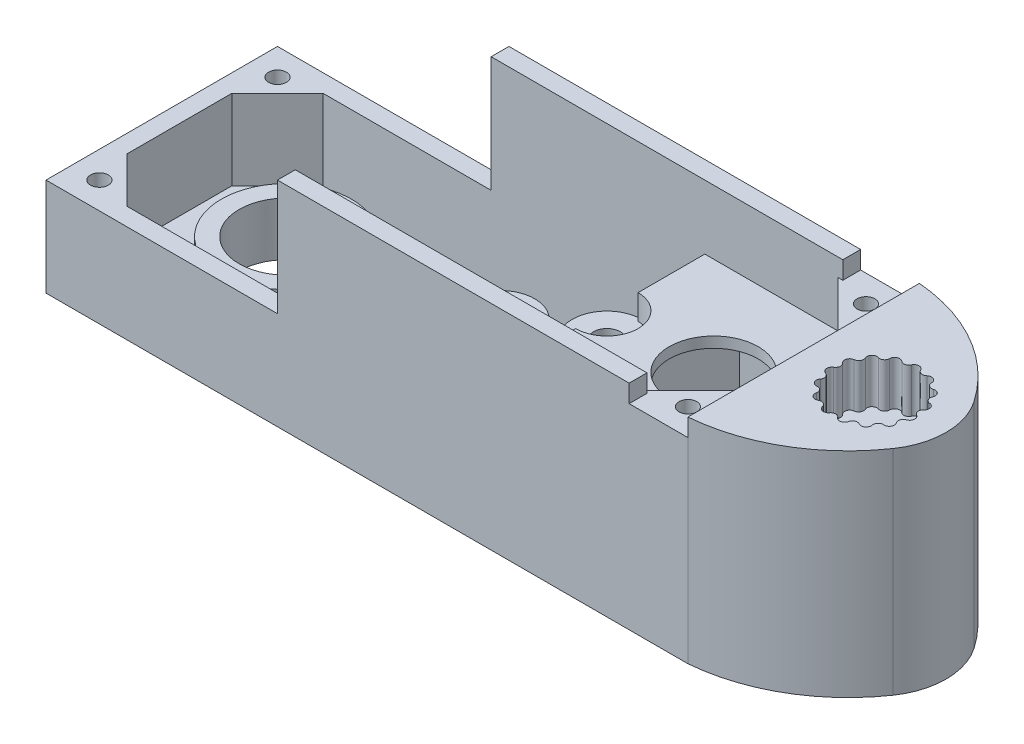
from build123d import *
from build123d.topology import SkipClean

# Parameters (mm, degrees)
ESQUISSE2_W                 = 36.05
ESQUISSE2_H                 = 13
ESQUISSE2_W_2               = 34.05
ESQUISSE2_H_2               = 11
BOSS_EXTRU_1_DEPTH          = 12
ESQUISSE3_W                 = 13
ESQUISSE3_H                 = 1
BOSS_EXTRU_2_DEPTH          = 36.05
ESQUISSE4_R                 = 2.65
ENL_V_MAT_EXTRU_1_DEPTH     = 12
ESQUISSE6_W                 = 3.9
ESQUISSE6_H                 = 1.5
ESQUISSE6_H_2               = 5
ESQUISSE6_H_3               = 7
BOSS_EXTRU_3_DEPTH          = 13
ENL_V_START                 = -6
ENL_V_MAT_EXTRU_2_OUTLINE_R = 0.75
ENL_V_MAT_EXTRU_2_DEPTH     = 6
ESQUISSE8_W                 = 13
ESQUISSE8_H                 = 6.5
ENL_V_MAT_EXTRU_3_DEPTH     = 40.261972696
ESQUISSE9_W                 = 8.1
ESQUISSE9_H                 = 11
BOSS_EXTRU_5_DEPTH          = 1.4
ESQUISSE11_R                = 2.5
ENL_V_MAT_EXTRU_4_DEPTH     = 38.987662471
CONG_2_R                    = 2
ESQUISSE10_W                = 8.1
ESQUISSE10_H                = 11
ENL_V_MAT_EXTRU_5_DEPTH     = 0.8
BOSS_EXTRU_6_DEPTH          = 2.6
ESQUISSE14_R                = 0.5
ENL_V_MAT_EXTRU_7_DEPTH     = 39.645860063
ESQUISSE15_R                = 0.75
ENL_V_MAT_EXTRU_8_DEPTH     = 38.702818197
ESQUISSE16_W                = 3.3
ESQUISSE16_H                = 13
ENL_V_MAT_EXTRU_9_DEPTH     = 1
ESQUISSE18_R                = 3.65
ESQUISSE18_R_2              = 2.65
BOSS_EXTRU_7_DEPTH          = 2
BOSS_EXTRU_8_REACH          = 40.942
ESQUISSE21_R                = 2.7
ENL_V_MAT_EXTRU_10_DEPTH    = 9.5
BOSS_EXTRU_9_START          = 3.5
ESQUISSE22_R                = 2.7
ESQUISSE22_R_2              = 1
BOSS_EXTRU_9_DEPTH          = 3.5


# Read off the part's stored shape, not the designer's step: Enlèv. mat.-Extru.2
with BuildPart() as part:
    # Esquisse2 → Boss.-Extru.1 (new body)
    # profile 1 of 3: a face of its own
    with BuildSketch(Plane(origin=(0, 0, 0), x_dir=(1, 0, 0), z_dir=(0, 1, 0))):
        with Locations((17.025, 5.5)):
            Rectangle(ESQUISSE2_W, ESQUISSE2_H)
        with Locations((17.025, 5.5)):
            Rectangle(ESQUISSE2_W_2, ESQUISSE2_H_2, mode=Mode.SUBTRACT)
    # profile 2 of 3: a face of its own
    with BuildSketch(Plane(origin=(0, 0, 0), x_dir=(1, 0, 0), z_dir=(0, 1, 0))):
        Polygon((0, 0), (2.560660172, 0), (0, 2.560660172), align=None)
    # profile 3 of 3: a face of its own
    with BuildSketch(Plane(origin=(0, 0, 0), x_dir=(1, 0, 0), z_dir=(0, 1, 0))):
        Polygon((0, 11), (0, 8.439339828), (2.560660172, 11), align=None)
    extrude(amount=BOSS_EXTRU_1_DEPTH)

    # Esquisse3 → Boss.-Extru.2 (add)
    with BuildSketch(Plane.ZY.offset(1)):
        with Locations((-5.5, 0.5)):
            Rectangle(ESQUISSE3_W, ESQUISSE3_H)
    extrude(amount=-BOSS_EXTRU_2_DEPTH)

    # Esquisse4 → Enlèv. mat.-Extru.1 (cut)
    with BuildSketch(Plane.XZ):
        with Locations(Location((6, -5.5, 0), (0, 0, 270))):
            Circle(ESQUISSE4_R)
        Polygon((34.05, 0), (28.45, 0), (25.95, -2.5), (25.95, -8.5), (28.45, -11), (34.05, -11), align=None)
    extrude(amount=-ENL_V_MAT_EXTRU_1_DEPTH, mode=Mode.SUBTRACT)

    # Esquisse6 → Boss.-Extru.3 (add)
    with BuildSketch(Plane.XY.offset(1)):
        with Locations((12, 0.75)):
            Rectangle(ESQUISSE6_W, ESQUISSE6_H)
        with Locations((18, 2.5)):
            Rectangle(ESQUISSE6_W, ESQUISSE6_H_2)
        with Locations((24, 3.5)):
            Rectangle(ESQUISSE6_W, ESQUISSE6_H_3)
    extrude(amount=-BOSS_EXTRU_3_DEPTH)

    # Enlèv. mat.-Extru.2 outline → Enlèv. mat.-Extru.2 (cut)
    with BuildSketch(Plane(origin=(0, 7, 0), x_dir=(1, 0, 0), z_dir=(0, 1, 0)).offset(ENL_V_START)):
        with BuildLine():
            Line((24, 7.45), (24, 11))
            Line((24, 11), (22.05, 11))
            Line((22.05, 11), (22.05, 5.5))
            ThreePointArc((22.05, 5.5), (22.621141777, 6.878858223), (24, 7.45))
        make_face()
        with BuildLine():
            Line((19.95, 5.5), (19.95, 11))
            Line((19.95, 11), (16.05, 11))
            Line((16.05, 11), (16.05, 5.5))
            ThreePointArc((16.05, 5.5), (18, 7.45), (19.95, 5.5))
        make_face()
        with BuildLine():
            ThreePointArc((24, 3.55), (22.621141777, 4.121141777), (22.05, 5.5))
            Line((22.05, 5.5), (22.05, 0))
            Line((22.05, 0), (24, 0))
            Line((24, 0), (24, 3.55))
        make_face()
        with BuildLine():
            Line((19.95, 0), (19.95, 5.5))
            ThreePointArc((19.95, 5.5), (18, 3.55), (16.05, 5.5))
            Line((16.05, 5.5), (16.05, 0))
            Line((16.05, 0), (19.95, 0))
        make_face()
        with BuildLine():
            Line((13.95, 5.5), (13.95, 11))
            Line((13.95, 11), (10.05, 11))
            Line((10.05, 11), (10.05, 5.5))
            ThreePointArc((10.05, 5.5), (12, 7.45), (13.95, 5.5))
        make_face()
        with BuildLine():
            Line((13.95, 0), (13.95, 5.5))
            ThreePointArc((13.95, 5.5), (12, 3.55), (10.05, 5.5))
            Line((10.05, 5.5), (10.05, 0))
            Line((10.05, 0), (13.95, 0))
        make_face()
        with Locations((24, 5.5)):
            Circle(ENL_V_MAT_EXTRU_2_OUTLINE_R)
        with Locations((18, 5.5)):
            Circle(ENL_V_MAT_EXTRU_2_OUTLINE_R)
        with Locations((12, 5.5)):
            Circle(ENL_V_MAT_EXTRU_2_OUTLINE_R)
    extrude(amount=ENL_V_MAT_EXTRU_2_DEPTH, mode=Mode.SUBTRACT)

    # Esquisse8 → Enlèv. mat.-Extru.3 (cut, through all)
    with BuildSketch(Plane(origin=(0, 0, -12), x_dir=(-1, 0, 0), z_dir=(0, 0, -1))):
        with Locations((-5.5, 8.75)):
            Rectangle(ESQUISSE8_W, ESQUISSE8_H)
    extrude(amount=-ENL_V_MAT_EXTRU_3_DEPTH, mode=Mode.SUBTRACT)

    # Esquisse9 → Boss.-Extru.5 (add)
    with BuildSketch(Plane(origin=(0, 7, 0), x_dir=(1, 0, 0), z_dir=(0, 1, 0))):
        with Locations((30, 5.5)):
            Rectangle(ESQUISSE9_W, ESQUISSE9_H)
        with BuildLine():
            Line((24, 0), (25.95, 0))
            Line((25.95, 0), (25.95, 11))
            Line((25.95, 11), (24, 11))
            Line((24, 11), (24, 7.45))
            Line((24, 7.45), (24, 7.25))
            ThreePointArc((24, 7.25), (25.237436867, 6.737436867), (25.75, 5.5))
            ThreePointArc((25.75, 5.5), (25.237436867, 4.262563133), (24, 3.75))
            Line((24, 3.75), (24, 3.55))
            Line((24, 3.55), (24, 0))
        make_face()
    extrude(amount=BOSS_EXTRU_5_DEPTH)

    # Esquisse11 → Enlèv. mat.-Extru.4 (cut, through all)
    with BuildSketch(Plane(origin=(0, 8.4, 0), x_dir=(1, 0, 0), z_dir=(0, 1, 0))):
        with Locations(Location((30, 5.5, 0), (0, 0, 180))):
            Circle(ESQUISSE11_R)
    extrude(amount=-ENL_V_MAT_EXTRU_4_DEPTH, mode=Mode.SUBTRACT)

    # Congé2
    # the kernel refuses this fillet: 2 mm, written as the material it adds along each edge
    with BuildSketch(Plane(origin=(12, 1, -5.5), x_dir=(-1, 0, 0), z_dir=(0, 0, 1))) as cong_2_piece_1:
        with BuildLine():
            CenterArc((3.272875656, -2), CONG_2_R, 90, 41.409622109)
            Line((1.95, -0.5), (1.95, 0))
            Line((1.95, 0), (3.272875656, 0))
        make_face()
    revolve(axis=Axis((12, 1, -5.5), (0, -1, 0)))
    with BuildSketch(Plane(origin=(18, 1, -5.5), x_dir=(-1, 0, 0), z_dir=(0, 0, 1))) as cong_2_piece_2:
        with BuildLine():
            CenterArc((1.95 + CONG_2_R, -CONG_2_R), CONG_2_R, 90, 90)
            Line((1.95, -CONG_2_R), (1.95, 0))
            Line((1.95, 0), (1.95 + CONG_2_R, 0))
        make_face()
    revolve(axis=Axis((18, 1, -5.5), (0, -1, 0)))
    with BuildSketch(Plane(origin=(24.000000001, 1, -5.500000001), x_dir=(-5.493679582300461e-10, 0, 1.0), z_dir=(1.0, 0, 5.493679582300461e-10))) as cong_2_piece_3:
        with BuildLine():
            CenterArc((1.950000001 + CONG_2_R, -CONG_2_R), CONG_2_R, 90, 90)
            Line((1.950000001, -CONG_2_R), (1.950000001, 0))
            Line((1.950000001, 0), (1.950000001 + CONG_2_R, 0))
        make_face()
    revolve(axis=Axis((24.000000001, 1, -5.500000001), (0, -1, 0)), revolution_arc=89.999999937)
    with BuildSketch(Plane(origin=(24.000000001, 1, -5.499999999), x_dir=(-1.0, 0, -5.49367047277821e-10), z_dir=(-5.49367047277821e-10, 0, 1.0))) as cong_2_piece_4:
        with BuildLine():
            CenterArc((1.950000001 + CONG_2_R, -CONG_2_R), CONG_2_R, 90, 90)
            Line((1.950000001, -CONG_2_R), (1.950000001, 0))
            Line((1.950000001, 0), (1.950000001 + CONG_2_R, 0))
        make_face()
    revolve(axis=Axis((24.000000001, 1, -5.499999999), (0, -1, 0)), revolution_arc=89.999999937)

    # Esquisse10 → Enlèv. mat.-Extru.5 (cut)
    with BuildSketch(Plane.XZ.offset(-7)):
        with Locations((30, -5.5)):
            Rectangle(ESQUISSE10_W, ESQUISSE10_H)
    extrude(amount=-ENL_V_MAT_EXTRU_5_DEPTH, mode=Mode.SUBTRACT)

    # Esquisse13 → Boss.-Extru.6 (add)
    with BuildSketch(Plane(origin=(0, 8.4, 0), x_dir=(1, 0, 0), z_dir=(0, 1, 0))):
        Polygon((34.05, 2.560660172), (31.489339828, 0), (34.05, 0), align=None)
        Polygon((31.489339828, 11), (34.05, 8.439339828), (34.05, 11), align=None)
    extrude(amount=BOSS_EXTRU_6_DEPTH)

    # Esquisse14 → Enlèv. mat.-Extru.7 (cut, through all)
    with BuildSketch(Plane(origin=(0, 11, 0), x_dir=(1, 0, 0), z_dir=(0, 1, 0))):
        with Locations(Location((33.55, 0.5, 0), (0, 0, 270))):
            Circle(ESQUISSE14_R)
        with Locations((33.55, 10.5)):
            Circle(ESQUISSE14_R)
        with Locations(Location((0.5, 0.5, 0), (0, 0, 270))):
            Circle(ESQUISSE14_R)
        with Locations(Location((0.5, 10.5, 0), (0, 0, 270))):
            Circle(ESQUISSE14_R)
    extrude(amount=-ENL_V_MAT_EXTRU_7_DEPTH, mode=Mode.SUBTRACT)

    # Esquisse15 → Enlèv. mat.-Extru.8 (cut, through all)
    with SkipClean():  # the faces are left unmerged after this step: merging them gives an invalid solid
        with BuildSketch(Plane(origin=(0, 7, 0), x_dir=(1, 0, 0), z_dir=(0, 1, 0))):
            with Locations(Location((24, 5.5, 0), (0, 0, 180))):
                Circle(ESQUISSE15_R)
            with Locations(Location((18, 5.5, 0), (0, 0, 180))):
                Circle(ESQUISSE15_R)
            with Locations(Location((12, 5.5, 0), (0, 0, 180))):
                Circle(ESQUISSE15_R)
        extrude(amount=-ENL_V_MAT_EXTRU_8_DEPTH, mode=Mode.SUBTRACT)
    add(part.part.scale(1), mode=Mode.REPLACE)  # the faces are merged on a copy

    # Esquisse16 → Enlèv. mat.-Extru.9 (cut)
    with BuildSketch(Plane(origin=(0, 12, 0), x_dir=(1, 0, 0), z_dir=(0, 1, 0))):
        with Locations((33.4, 5.5)):
            Rectangle(ESQUISSE16_W, ESQUISSE16_H)
    extrude(amount=-ENL_V_MAT_EXTRU_9_DEPTH, mode=Mode.SUBTRACT)

    # Esquisse18 → Boss.-Extru.7 (add)
    with BuildSketch(Plane(origin=(0, 1, 0), x_dir=(1, 0, 0), z_dir=(0, 1, 0))):
        with Locations(Location((6, 5.5, 0), (0, 0, 28.17315389))):
            Circle(ESQUISSE18_R)
        with Locations(Location((6, 5.5, 0), (0, 0, 90))):
            Circle(ESQUISSE18_R_2, mode=Mode.SUBTRACT)
    extrude(amount=BOSS_EXTRU_7_DEPTH)

    # Boss.-Extru.8: up to this face of the body (flat: up to its plane)
    boss_extru_8_end = Plane(part.part.faces().sort_by_distance((21.875, 12, 0.5))[0])
    # Esquisse20 → Boss.-Extru.8 (add, up to the picked face)
    with BuildSketch(Plane.XZ, mode=Mode.PRIVATE) as boss_extru_8_sk1:
        with BuildLine():
            ThreePointArc((42.346904346, -7.765043428), (43.05, -5.5), (42.346904346, -3.234956572))
            ThreePointArc((42.346904346, -3.234956572), (39.175262197, -0.295926263), (35.05, 1))
            Line((35.05, 1), (35.05, -12))
            ThreePointArc((35.05, -12), (39.175262197, -10.704073737), (42.346904346, -7.765043428))
        make_face()
        with BuildLine():
            ThreePointArc((38.316527577, -3.290306638), (38.155179385, -3.490199993), (37.89866666, -3.476350305))
            ThreePointArc((37.89866666, -3.476350305), (37.742556317, -3.438480009), (37.591089868, -3.49198247))
            ThreePointArc((37.591089868, -3.49198247), (37.493400297, -3.619502454), (37.48117634, -3.779674778))
            ThreePointArc((37.48117634, -3.779674778), (37.415081384, -4.027912666), (37.175112173, -4.119593472))
            ThreePointArc((37.175112173, -4.119593472), (37.017095041, -4.148493032), (36.900484966, -4.258976917))
            ThreePointArc((36.900484966, -4.258976917), (36.863108153, -4.415206147), (36.917088965, -4.566502777))
            ThreePointArc((36.917088965, -4.566502777), (36.957675664, -4.820162612), (36.775742825, -5.001521467))
            ThreePointArc((36.775742825, -5.001521467), (36.643141502, -5.092193887), (36.581550742, -5.240555528))
            ThreePointArc((36.581550742, -5.240555528), (36.610949476, -5.398480551), (36.721801286, -5.514740926))
            ThreePointArc((36.721801286, -5.514740926), (36.86205183, -5.729962619), (36.769613203, -5.96964093))
            ThreePointArc((36.769613203, -5.96964093), (36.685355662, -6.106408123), (36.689433819, -6.266994446))
            ThreePointArc((36.689433819, -6.266994446), (36.780524793, -6.399308591), (36.929080315, -6.460430236))
            ThreePointArc((36.929080315, -6.460430236), (37.144744112, -6.6), (37.157783175, -6.856555209))
            ThreePointArc((37.157783175, -6.856555209), (37.136438311, -7.015768887), (37.205480234, -7.160813057))
            ThreePointArc((37.205480234, -7.160813057), (37.342512991, -7.244638006), (37.503085626, -7.240052432))
            ThreePointArc((37.503085626, -7.240052432), (37.756872445, -7.279837388), (37.873134626, -7.508908768))
            ThreePointArc((37.873134626, -7.508908768), (37.91839316, -7.663039439), (38.040460874, -7.767462001))
            ThreePointArc((38.040460874, -7.767462001), (38.199741205, -7.788303659), (38.344566485, -7.718803755))
            ThreePointArc((38.344566485, -7.718803755), (38.59259428, -7.651924722), (38.791976792, -7.813903752))
            ThreePointArc((38.791976792, -7.813903752), (38.896013111, -7.936300822), (39.05, -7.982046167))
            ThreePointArc((39.05, -7.982046167), (39.203986889, -7.936300822), (39.308023208, -7.813903752))
            ThreePointArc((39.308023208, -7.813903752), (39.50740572, -7.651924722), (39.755433515, -7.718803755))
            ThreePointArc((39.755433515, -7.718803755), (39.900258795, -7.788303659), (40.059539126, -7.767462001))
            ThreePointArc((40.059539126, -7.767462001), (40.18160684, -7.663039439), (40.226865374, -7.508908768))
            ThreePointArc((40.226865374, -7.508908768), (40.343127555, -7.279837388), (40.596914374, -7.240052432))
            ThreePointArc((40.596914374, -7.240052432), (40.757487009, -7.244638006), (40.894519766, -7.160813057))
            ThreePointArc((40.894519766, -7.160813057), (40.963561689, -7.015768887), (40.942216825, -6.856555209))
            ThreePointArc((40.942216825, -6.856555209), (40.955255888, -6.6), (41.170919685, -6.460430236))
            ThreePointArc((41.170919685, -6.460430236), (41.319475207, -6.399308591), (41.410566181, -6.266994446))
            ThreePointArc((41.410566181, -6.266994446), (41.414644338, -6.106408123), (41.330386797, -5.96964093))
            ThreePointArc((41.330386797, -5.96964093), (41.23794817, -5.729962619), (41.378198714, -5.514740926))
            ThreePointArc((41.378198714, -5.514740926), (41.489050524, -5.398480551), (41.518449258, -5.240555528))
            ThreePointArc((41.518449258, -5.240555528), (41.456858498, -5.092193887), (41.324257175, -5.001521467))
            ThreePointArc((41.324257175, -5.001521467), (41.142324336, -4.820162612), (41.182911035, -4.566502777))
            ThreePointArc((41.182911035, -4.566502777), (41.236891847, -4.415206147), (41.199515034, -4.258976917))
            ThreePointArc((41.199515034, -4.258976917), (41.082904959, -4.148493032), (40.924887827, -4.119593472))
            ThreePointArc((40.924887827, -4.119593472), (40.684918616, -4.027912666), (40.61882366, -3.779674778))
            ThreePointArc((40.61882366, -3.779674778), (40.606599703, -3.619502454), (40.508910132, -3.49198247))
            ThreePointArc((40.508910132, -3.49198247), (40.357443683, -3.438480009), (40.20133334, -3.476350305))
            ThreePointArc((40.20133334, -3.476350305), (39.944820615, -3.490199993), (39.783472423, -3.290306638))
            ThreePointArc((39.783472423, -3.290306638), (39.707157329, -3.148953871), (39.566046415, -3.072192497))
            ThreePointArc((39.566046415, -3.072192497), (39.405913518, -3.084922522), (39.27870286, -3.183014556))
            ThreePointArc((39.27870286, -3.183014556), (39.05, -3.3), (38.82129714, -3.183014556))
            ThreePointArc((38.82129714, -3.183014556), (38.694086482, -3.084922522), (38.533953585, -3.072192497))
            ThreePointArc((38.533953585, -3.072192497), (38.392842671, -3.148953871), (38.316527577, -3.290306638))
        make_face(mode=Mode.SUBTRACT)
    boss_extru_8_tool1 = split(extrude(boss_extru_8_sk1.sketch, amount=-BOSS_EXTRU_8_REACH, mode=Mode.PRIVATE), bisect_by=boss_extru_8_end, keep=Keep.BOTH, mode=Mode.PRIVATE)
    add(boss_extru_8_tool1.solids().sort_by(Axis((42.897357, 0, -5.5), (0, 1, 0)))[0])

    # Esquisse21 → Enlèv. mat.-Extru.10 (cut)
    with BuildSketch(Plane.XZ):
        with Locations(Location((39.05, -5.5, 0), (0, 0, 270))):
            Circle(ESQUISSE21_R)
    extrude(amount=-ENL_V_MAT_EXTRU_10_DEPTH, mode=Mode.SUBTRACT)

    # Esquisse22 → Boss.-Extru.9 (add)
    with BuildSketch(Plane.XZ.offset(-9.5).offset(BOSS_EXTRU_9_START)):
        with Locations(Location((39.05, -5.5, 0), (0, 0, 270))):
            Circle(ESQUISSE22_R)
        with Locations(Location((39.05, -5.5, 0), (0, 0, 270))):
            Circle(ESQUISSE22_R_2, mode=Mode.SUBTRACT)
    extrude(amount=-BOSS_EXTRU_9_DEPTH)


solid = part.part
